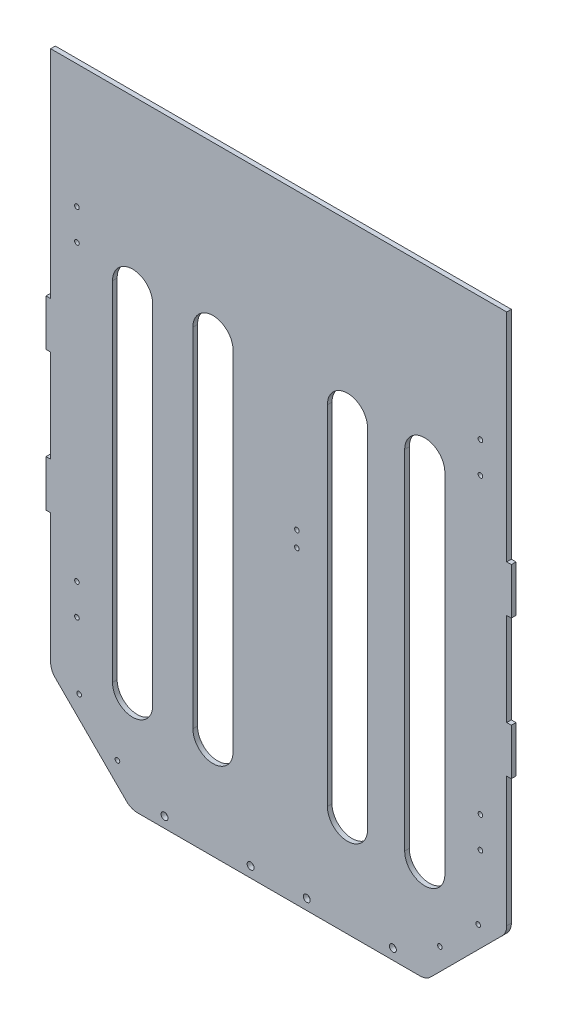
from build123d import *

# Parameters (mm, degrees)
EXTRUDE_1_DEPTH     = 3
CUT_EXTRUDE_2_DEPTH = 228.06662018
SKETCH_2_R          = 1.5
SKETCH_2_R_2        = 2.25
CUT_EXTRUDE_1_DEPTH = 10
SKETCH_4_R          = 1.5
CUT_EXTRUDE_3_DEPTH = 228.06662018
CUT_EXTRUDE_4_DEPTH = 228.06662018
FILLET_3_R          = 10
SKETCH_8_R          = 1.5
CUT_EXTRUDE_5_DEPTH = 228.06662018
SKETCH_9_W          = 295
SKETCH_9_H          = 60
EXTRUDE_2_DEPTH     = 3


with BuildPart() as part:
    # 草图1 → 凸台-拉伸1 (new body)
    with BuildSketch(Plane.XY):
        Polygon((-147.5, 90), (-150.5, 90), (-150.5, 60), (-147.5, 60), (-147.5, 0), (-150.5, 0), (-150.5, -30), (-147.5, -30), (-147.5, -90), (-147.5, -120), (-147.5, -170), (147.5, -170), (147.5, -120), (147.5, -90), (147.5, -30), (150.5, -30), (150.5, 0), (147.5, 0), (147.5, 60), (150.5, 60), (150.5, 90), (147.5, 90), (147.5, 170), (-147.5, 170), align=None)
    extrude(amount=EXTRUDE_1_DEPTH)

    # 草图3 → 切除-拉伸2 (cut, through all)
    with BuildSketch(Plane.XY.offset(3)):
        Polygon((-147.5, -118), (-95.5, -170), (-147.5, -170), align=None)
        Polygon((147.5, -170), (147.5, -118), (95.5, -170), align=None)
    extrude(amount=-CUT_EXTRUDE_2_DEPTH, mode=Mode.SUBTRACT)

    # 草图2 → 切除-拉伸1 (cut)
    with BuildSketch(Plane.XY.offset(3)):
        with Locations((11.800454572, 40)):
            Circle(SKETCH_2_R)
        with Locations((11.800454572, 30)):
            Circle(SKETCH_2_R)
        with Locations((-73.85, -163.15)):
            Circle(SKETCH_2_R_2)
        with Locations((-18.15, -163.15)):
            Circle(SKETCH_2_R_2)
        with Locations((18.15, -163.15)):
            Circle(SKETCH_2_R_2)
        with Locations((73.85, -163.15)):
            Circle(SKETCH_2_R_2)
    extrude(amount=-CUT_EXTRUDE_1_DEPTH, mode=Mode.SUBTRACT)

    # 草图4 → 切除-拉伸3 (cut, through all)
    with BuildSketch(Plane.XY.offset(3)):
        with Locations((130.5, 150)):
            Circle(SKETCH_4_R)
        with Locations((130.5, 130)):
            Circle(SKETCH_4_R)
        with Locations((130.5, -60)):
            Circle(SKETCH_4_R)
        with Locations((130.5, -80)):
            Circle(SKETCH_4_R)
        with Locations((-130.5, -80)):
            Circle(SKETCH_4_R)
        with Locations((-130.5, -60)):
            Circle(SKETCH_4_R)
        with Locations((-130.5, 130)):
            Circle(SKETCH_4_R)
        with Locations((-130.5, 150)):
            Circle(SKETCH_4_R)
    extrude(amount=-CUT_EXTRUDE_3_DEPTH, mode=Mode.SUBTRACT)

    # 草图5 → 切除-拉伸4 (cut, through all)
    with BuildSketch(Plane.XY.offset(3)):
        with BuildLine():
            Line((-81.5, 120), (-81.5, -105))
            ThreePointArc((-81.5, -105), (-94.5, -118), (-107.5, -105))
            Line((-107.5, -105), (-107.5, 120))
            ThreePointArc((-107.5, 120), (-94.5, 133), (-81.5, 120))
        make_face()
        with BuildLine():
            Line((-29.5, 120), (-29.5, -105))
            ThreePointArc((-29.5, -105), (-42.5, -118), (-55.5, -105))
            Line((-55.5, -105), (-55.5, 120))
            ThreePointArc((-55.5, 120), (-42.5, 133), (-29.5, 120))
        make_face()
        with BuildLine():
            Line((57.5, 120), (57.5, -105))
            ThreePointArc((57.5, -105), (44.5, -118), (31.5, -105))
            Line((31.5, -105), (31.5, 120))
            ThreePointArc((31.5, 120), (44.5, 133), (57.5, 120))
        make_face()
        with BuildLine():
            Line((107.5, 120), (107.5, -105))
            ThreePointArc((107.5, -105), (94.5, -118), (81.5, -105))
            Line((81.5, -105), (81.5, 120))
            ThreePointArc((81.5, 120), (94.5, 133), (107.5, 120))
        make_face()
    extrude(amount=-CUT_EXTRUDE_4_DEPTH, mode=Mode.SUBTRACT)

    # 圆角3
    fillet_3_edges = [part.edges().sort_by_distance(p)[0] for p in [
        (147.5, -118, 1.5),
        (95.5, -170, 1.5),
        (-95.5, -170, 1.5),
        (-147.5, -118, 1.5),
    ]]
    fillet(fillet_3_edges, radius=FILLET_3_R)

    # 草图8 → 切除-拉伸5 (cut, through all)
    with BuildSketch(Plane.XY.offset(3)):
        with Locations((-129.044105664, -122.313758713)):
            Circle(SKETCH_8_R)
        with Locations((-104.295368322, -147.062496054)):
            Circle(SKETCH_8_R)
        with Locations((104.295368322, -147.062496054)):
            Circle(SKETCH_8_R)
        with Locations((129.044105664, -122.313758713)):
            Circle(SKETCH_8_R)
    extrude(amount=-CUT_EXTRUDE_5_DEPTH, mode=Mode.SUBTRACT)

    # 草图9 → 凸台-拉伸2 (add)
    with BuildSketch(Plane.XY.offset(3)):
        with Locations((0, 200)):
            Rectangle(SKETCH_9_W, SKETCH_9_H)
    extrude(amount=-EXTRUDE_2_DEPTH)


solid = part.part
